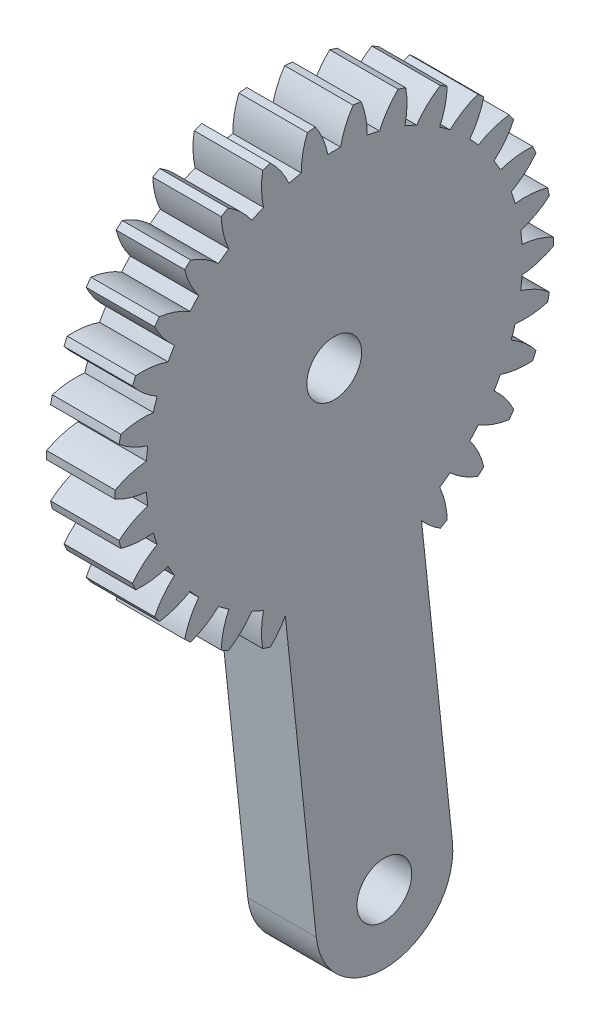
from build123d import *

# Parameters (mm, degrees)
BASPROSKE_W         = 5
BASPROSKE_H         = 16
TOOTHCUT_DEPTH      = 24.173260453
TEETHCUTS_COUNT     = 30
TEETHCUTS_ANGLE     = 348
BORSKE_R            = 0.4
BORE_DEPTH          = 50.0000508
SKETCH1_R           = 2
BOSS_EXTRUDE1_DEPTH = 5
SKETCH2_R           = 2
CUT_EXTRUDE1_DEPTH  = 44.650585033
FILLET1_R           = 5


with BuildPart() as part:
    # BasProSke → Base-Revolve (revolve)
    with BuildSketch(Plane(origin=(0, 0, 0), x_dir=(1, 0, 0), z_dir=(0, 1, 0)), mode=Mode.PRIVATE) as base_revolve_sk:
        with Locations((2.5, 8)):
            Rectangle(BASPROSKE_W, BASPROSKE_H)
    revolve(base_revolve_sk.sketch.rotate(Axis((-10, 0, 0), (1, 0, 0)), 180), axis=Axis((-10, 0, 0), (1, 0, 0)))

    # TooCutSke → ToothCut (cut, through all)
    with BuildSketch(Plane(origin=(0, 0, 0), x_dir=(0, 0, -1), z_dir=(1, 0, 0))):
        with BuildLine():
            ThreePointArc((0.466400716, 13.741086979), (0, 13.749), (-0.466400716, 13.741086979))
            ThreePointArc((-0.466400716, 13.741086979), (-0.819142092, 14.899954875), (-1.3974676, 15.964351834))
            ThreePointArc((-1.3974676, 15.964351834), (0, 16.0254), (1.3974676, 15.964351834))
            ThreePointArc((1.3974676, 15.964351834), (0.819142092, 14.899954875), (0.466400716, 13.741086979))
        make_face()
    toothcut = extrude(amount=TOOTHCUT_DEPTH, mode=Mode.SUBTRACT)

    # TeethCuts: ToothCut ×30 about axis
    teethcuts_axis = Axis((-10, 0, 0), (1, 0, 0))
    for i in range(1, TEETHCUTS_COUNT):
        add(toothcut.rotate(teethcuts_axis, i * TEETHCUTS_ANGLE / (TEETHCUTS_COUNT - 1)), mode=Mode.SUBTRACT)

    # BorSke → Bore (cut, symmetric)
    with BuildSketch(Plane(origin=(0, 0, 0), x_dir=(0, 0, -1), z_dir=(1, 0, 0))):
        with Locations(Location((0, 0, 0), (0, 0, 180))):
            Circle(BORSKE_R)
    extrude(amount=BORE_DEPTH, both=True, mode=Mode.SUBTRACT)

    # Sketch1 → Boss-Extrude1 (add)
    with BuildSketch(Plane(origin=(5, 0, 0), x_dir=(0, 0, -1), z_dir=(1, 0, 0))):
        Polygon((4.972609477, 0.522642316), (9.153748008, -39.258233498), (-0.791470946, -40.303518131), (-4.972609477, -0.522642316), align=None)
        with Locations((3.658496214, -34.808266338)):
            Circle(SKETCH1_R, mode=Mode.SUBTRACT)
    extrude(amount=-BOSS_EXTRUDE1_DEPTH)

    # Sketch2 → Cut-Extrude1 (cut, through all)
    with BuildSketch(Plane(origin=(5, 0, 0), x_dir=(0, 0, -1), z_dir=(1, 0, 0))):
        Circle(SKETCH2_R)
    extrude(amount=-CUT_EXTRUDE1_DEPTH, mode=Mode.SUBTRACT)

    # Fillet1
    fillet1_edges = [part.edges().sort_by_distance(p)[0] for p in [
        (2.5, -39.258233498, -9.153748008),
        (2.5, -40.303518131, 0.791470946),
    ]]
    fillet(fillet1_edges, radius=FILLET1_R - 0.0001)  # a hair under: the kernel refuses the full size


solid = part.part
